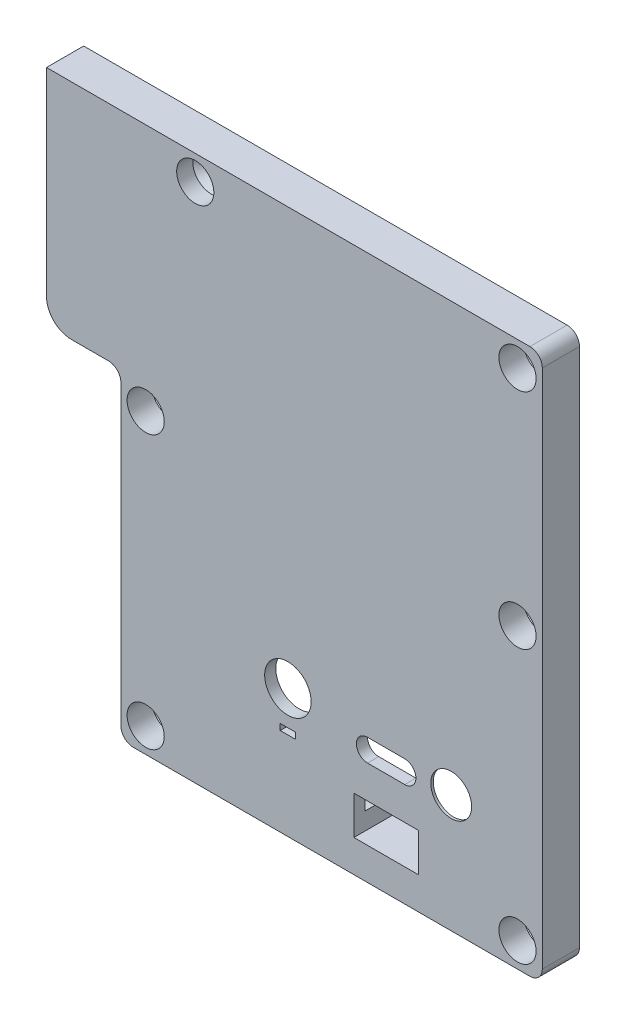
from build123d import *

# Parameters (mm, degrees)
EXTRUDE_1_DEPTH          = 6
EXTRUDE_4_DEPTH          = 6.8
CUT_EXTRUDE_START        = -1.8
CUT_EXTRUDE_6_DEPTH      = 110.619208398
FILLET_1_R               = 2
CUT_EXTRUDE_4_DEPTH      = 112.419208398
CUT_EXTRUDE_4_DEPTH_BACK = 112.419208398
SKETCH_4_R               = 1.6
SKETCH_5_R               = 3.75
SKETCH_5_W               = 10.4
SKETCH_5_H               = 6.2
SKETCH_5_W_2             = 2.5
SKETCH_5_H_2             = 1
SKETCH_5_W_3             = 9.4
SKETCH_5_H_3             = 11.4
CUT_EXTRUDE_5_DEPTH      = 112.419208398
SKETCH_5_3_W             = 9.4
SKETCH_5_3_H             = 11.4
SKETCH_5_3_R             = 3.3
EXTRUDE_5_DEPTH          = 0.4
SKETCH_6_W               = 20
SKETCH_6_H               = 36
EXTRUDE_7_DEPTH          = 6
FILLET_2_R               = 2
FILLET_3_R               = 4
SKETCH_7_R               = 1.4
CUT_EXTRUDE_7_DEPTH      = 20
SKETCH_4_3_R             = 3
SKETCH_4_3_R_2           = 1.6
CUT_EXTRUDE_8_DEPTH      = 4
SKETCH_8_R               = 1.4
CUT_EXTRUDE_9_DEPTH      = 7
CHAMFER_1_SIZE           = 1.4


with BuildPart() as part:
    # 草图1 → 凸台-拉伸1 (new body)
    with BuildSketch(Plane.XY):
        Polygon((0, 0), (68, 0), (68, 88), (8, 88), (8, 52), (0, 52), align=None)
    extrude(amount=-EXTRUDE_1_DEPTH)

    # 草图1<2> → 凸台-拉伸4 (add)
    with BuildSketch(Plane.XY):
        Polygon((2.2, 49.8), (2.2, 2.2), (65.8, 2.2), (65.8, 85.8), (10.2, 85.8), (10.2, 49.8), align=None)
        Polygon((8, 44), (8, 8), (60, 8), (60, 80), (16, 80), (16, 44), align=None, mode=Mode.SUBTRACT)
    extrude(amount=-EXTRUDE_4_DEPTH)

    # 草图1<5> → 切除-拉伸6 (cut, through all)
    with BuildSketch(Plane.XY.offset(CUT_EXTRUDE_START)):
        Polygon((16, 80), (16, 44), (8, 44), (8, 8), (60, 8), (60, 80), align=None)
    extrude(amount=-CUT_EXTRUDE_6_DEPTH, mode=Mode.SUBTRACT)

    # 圆角1
    fillet_1_edges = [part.edges().sort_by_distance(p)[0] for p in [
        (68, 88, -3),
        (68, 0, -3),
        (0, 0, -3),
        (10.2, 85.8, -6.4),
        (65.8, 85.8, -6.4),
        (65.8, 2.2, -6.4),
        (2.2, 2.2, -6.4),
        (2.2, 49.8, -6.4),
    ]]
    fillet(fillet_1_edges, radius=FILLET_1_R)

    # 草图4 → 切除-拉伸4 (cut, two sides: drawn at the far end of the back side and taken through both)
    with BuildSketch(Plane.XY.offset(-CUT_EXTRUDE_4_DEPTH_BACK)):
        with Locations((12, 84)):
            Circle(SKETCH_4_R)
        with Locations((64, 84)):
            Circle(SKETCH_4_R)
        with Locations((64, 4)):
            Circle(SKETCH_4_R)
        with Locations((4, 48)):
            Circle(SKETCH_4_R)
        with Locations((4, 4)):
            Circle(SKETCH_4_R)
        with Locations((64, 48)):
            Circle(SKETCH_4_R)
    extrude(amount=CUT_EXTRUDE_4_DEPTH + CUT_EXTRUDE_4_DEPTH_BACK, mode=Mode.SUBTRACT)

    # 草图5 → 切除-拉伸5 (cut, through all)
    with BuildSketch(Plane.XY):
        with Locations((26.95, 20.7)):
            Circle(SKETCH_5_R)
        with Locations((42.8, 8.3)):
            Rectangle(SKETCH_5_W, SKETCH_5_H)
        with Locations((26.95, 14.7)):
            Rectangle(SKETCH_5_W_2, SKETCH_5_H_2)
        with Locations((53.3, 18.1)):
            Rectangle(SKETCH_5_W_3, SKETCH_5_H_3)
        with BuildLine():
            Line((39.8, 16.7), (45.8, 16.7))
            ThreePointArc((45.8, 16.7), (47.6, 18.5), (45.8, 20.3))
            Line((45.8, 20.3), (39.8, 20.3))
            ThreePointArc((39.8, 20.3), (38, 18.5), (39.8, 16.7))
        make_face()
    extrude(amount=-CUT_EXTRUDE_5_DEPTH, mode=Mode.SUBTRACT)

    # 草图5<3> → 凸台-拉伸5 (add)
    with BuildSketch(Plane.XY):
        with Locations((53.3, 18.1)):
            Rectangle(SKETCH_5_3_W, SKETCH_5_3_H)
        with Locations((53.3, 19)):
            Circle(SKETCH_5_3_R, mode=Mode.SUBTRACT)
    extrude(amount=-EXTRUDE_5_DEPTH)

    # 草图6 → 凸台-拉伸7 (add)
    with BuildSketch(Plane.XY):
        with Locations((-2, 70)):
            Rectangle(SKETCH_6_W, SKETCH_6_H)
    extrude(amount=-EXTRUDE_7_DEPTH)

    # 圆角2
    fillet_2_edges = [part.edges().sort_by_distance(p)[0] for p in [
        (0, 52, -3),
    ]]
    fillet(fillet_2_edges, radius=FILLET_2_R)

    # 圆角3
    fillet_3_edges = [part.edges().sort_by_distance(p)[0] for p in [
        (-12, 52, -3),
    ]]
    fillet(fillet_3_edges, radius=FILLET_3_R)

    # 草图7 → 切除-拉伸7 (cut)
    with BuildSketch(Plane.ZY.offset(12)):
        with Locations((-3, 82)):
            Circle(SKETCH_7_R)
        with Locations((-3, 62)):
            Circle(SKETCH_7_R)
    extrude(amount=-CUT_EXTRUDE_7_DEPTH, mode=Mode.SUBTRACT)

    # 草图4<3> → 切除-拉伸8 (cut)
    # profile 1 of 6: a face of its own
    with BuildSketch(Plane.XY):
        with Locations((12, 84)):
            Circle(SKETCH_4_3_R)
        with Locations((12, 84)):
            Circle(SKETCH_4_3_R_2, mode=Mode.SUBTRACT)
    # profile 2 of 6: a face of its own
    with BuildSketch(Plane.XY):
        with Locations((64, 84)):
            Circle(SKETCH_4_3_R)
        with Locations((64, 84)):
            Circle(SKETCH_4_3_R_2, mode=Mode.SUBTRACT)
    # profile 3 of 6: a face of its own
    with BuildSketch(Plane.XY):
        with Locations((4, 48)):
            Circle(SKETCH_4_3_R)
        with Locations((4, 48)):
            Circle(SKETCH_4_3_R_2, mode=Mode.SUBTRACT)
    # profile 4 of 6: a face of its own
    with BuildSketch(Plane.XY):
        with Locations((64, 48)):
            Circle(SKETCH_4_3_R)
        with Locations((64, 48)):
            Circle(SKETCH_4_3_R_2, mode=Mode.SUBTRACT)
    # profile 5 of 6: a face of its own
    with BuildSketch(Plane.XY):
        with Locations((4, 4)):
            Circle(SKETCH_4_3_R)
        with Locations((4, 4)):
            Circle(SKETCH_4_3_R_2, mode=Mode.SUBTRACT)
    # profile 6 of 6: a face of its own
    with BuildSketch(Plane.XY):
        with Locations((64, 4)):
            Circle(SKETCH_4_3_R)
        with Locations((64, 4)):
            Circle(SKETCH_4_3_R_2, mode=Mode.SUBTRACT)
    extrude(amount=-CUT_EXTRUDE_8_DEPTH, mode=Mode.SUBTRACT)

    # 草图8 → 切除-拉伸9 (cut)
    with BuildSketch(Plane.XZ):
        with Locations(Location((58, -3, 0), (0, 0, 270))):
            Circle(SKETCH_8_R)
        with Locations(Location((10, -3, 0), (0, 0, 270))):
            Circle(SKETCH_8_R)
        with Locations(Location((34, -3, 0), (0, 0, 270))):
            Circle(SKETCH_8_R)
    extrude(amount=-CUT_EXTRUDE_9_DEPTH, mode=Mode.SUBTRACT)

    # 倒角1
    chamfer_1_edges = [part.edges().sort_by_distance(p)[0] for p in [
        (2.4, 4, -4),
        (62.4, 48, -4),
        (2.4, 48, -4),
        (62.4, 84, -4),
        (62.4, 4, -4),
        (9, 84, -4),
    ]]
    chamfer(chamfer_1_edges, length=CHAMFER_1_SIZE - 0.0001)  # a hair under: the kernel refuses the full size


solid = part.part
